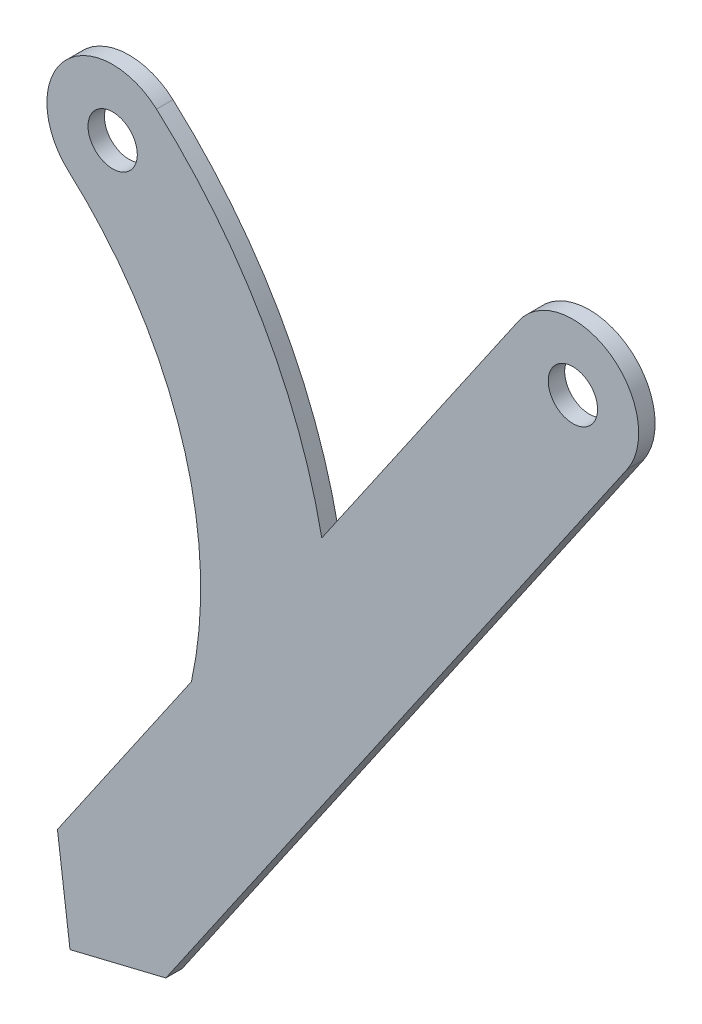
from build123d import *

# Parameters (mm, degrees)
ESQUISSE1_R               = 1.5
T_LE_DE_BASE_PLI_E1_DEPTH = 1


# Sheet-metal steps are written as plain solids
with BuildPart() as part:
    # Esquisse1 → Tôle de base pliée1 (new body)
    with BuildSketch(Plane.XY):
        with BuildLine():
            Line((52.013409723, -33.289312572), (23.9579476, -74.104755262))
            Line((23.9579476, -74.104755262), (18.128307715, -75.524367467))
            Line((18.128307715, -75.524367467), (17.365223528, -69.573090081))
            Line((17.365223528, -69.573090081), (25.513216292, -57.719286703))
            ThreePointArc((25.513216292, -57.719286703), (24.916294507, -45.140612284), (18.054996129, -34.581163893))
            ThreePointArc((18.054996129, -34.581163893), (17.742778185, -28.932932315), (23.391009763, -28.620714371))
            ThreePointArc((23.391009763, -28.620714371), (29.837572726, -36.588371526), (33.443630358, -46.182019577))
            Line((33.443630358, -46.182019577), (45.420685651, -28.757647391))
            ThreePointArc((45.420685651, -28.757647391), (50.982880277, -27.727117945), (52.013409723, -33.289312572))
        make_face()
        with Locations((20.723002946, -31.600939132)):
            Circle(ESQUISSE1_R, mode=Mode.SUBTRACT)
        with Locations((48.717047687, -31.023479981)):
            Circle(ESQUISSE1_R, mode=Mode.SUBTRACT)
    extrude(amount=-T_LE_DE_BASE_PLI_E1_DEPTH)


solid = part.part
